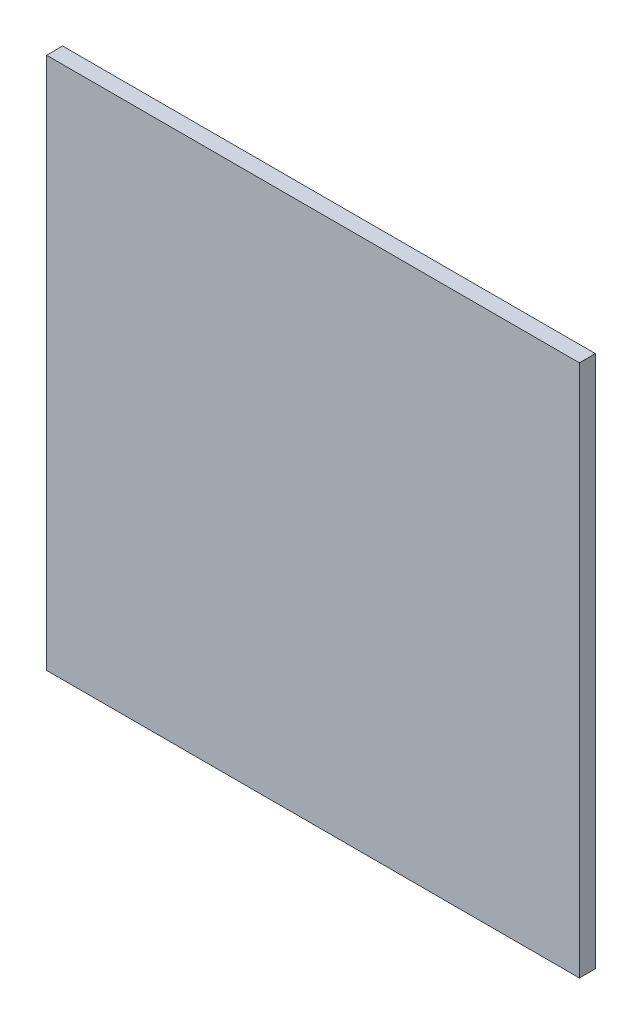
from build123d import *

# Parameters (mm, degrees)
SKETCH_1_W      = 600
SKETCH_1_H      = 600
EXTRUDE_1_DEPTH = 18


with BuildPart() as part:
    # Эскиз1 → Бобышка-Вытянуть1 (new body)
    with BuildSketch(Plane.XY):
        Rectangle(SKETCH_1_W, SKETCH_1_H)
    extrude(amount=EXTRUDE_1_DEPTH)


solid = part.part
